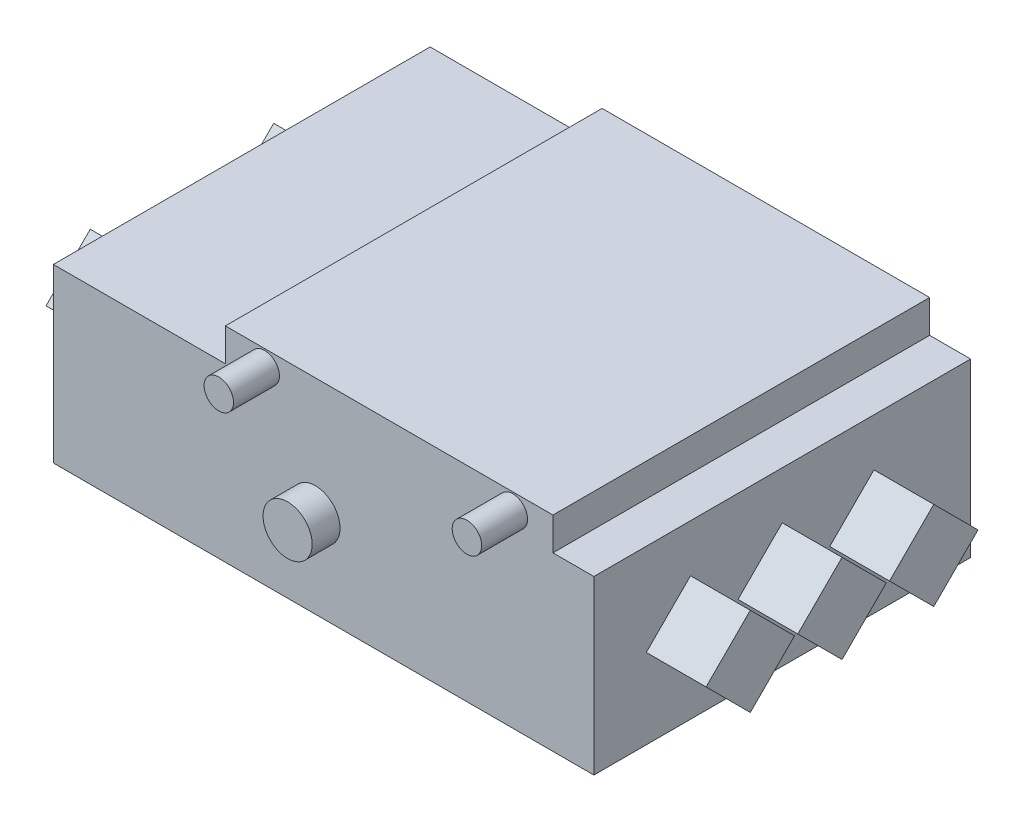
from build123d import *

# Parameters (mm, degrees)
SKETCH1_W           = 330
SKETCH1_H           = 105
BOSS_EXTRUDE1_DEPTH = 230
SKETCH2_W           = 200
SKETCH2_H           = 230
BOSS_EXTRUDE2_DEPTH = 20
SKETCH5_R           = 9
BOSS_EXTRUDE4_DEPTH = 28
SKETCH5_5_R         = 15
BOSS_EXTRUDE5_DEPTH = 17
BOSS_EXTRUDE6_DEPTH = 36.5
MIRROR1_START       = 20.04628694
MIRROR1_OUTLINE_W   = 36.5
MIRROR1_OUTLINE_H   = 38.2
MIRROR1_DEPTH       = 38.2
MIRROR1_START_2     = 99.242246433
MIRROR1_2_OUTLINE_W = 36.5
MIRROR1_2_OUTLINE_H = 38.2
MIRROR1_2_DEPTH     = 38.2


# Read off the part's stored shape, not the designer's step: Mirror1
with BuildPart() as part:
    # Sketch1 → Boss-Extrude1 (new body)
    with BuildSketch(Plane.XY):
        Rectangle(SKETCH1_W, SKETCH1_H)
    extrude(amount=BOSS_EXTRUDE1_DEPTH)

    # Sketch2 → Boss-Extrude2 (add)
    with BuildSketch(Plane(origin=(0, 52.5, 0), x_dir=(1, 0, 0), z_dir=(0, 1, 0))):
        with Locations((40, -115)):
            Rectangle(SKETCH2_W, SKETCH2_H)
    extrude(amount=BOSS_EXTRUDE2_DEPTH)

    # Sketch5 → Boss-Extrude4 (add)
    with BuildSketch(Plane.XY.offset(230)):
        with Locations((115.5, 62.5)):
            Circle(SKETCH5_R)
        with Locations((-36, 62.5)):
            Circle(SKETCH5_R)
    extrude(amount=BOSS_EXTRUDE4_DEPTH)

    # Sketch5<5> → Boss-Extrude5 (add)
    with BuildSketch(Plane.XY.offset(230)):
        with Locations((-5, 0.5)):
            Circle(SKETCH5_5_R)
    extrude(amount=BOSS_EXTRUDE5_DEPTH)

    # Sketch6 → Boss-Extrude6 (add)
    with BuildSketch(Plane(origin=(165, 0, 0), x_dir=(0, 0, -1), z_dir=(1, 0, 0))):
        Polygon((-86.011479041, -3.638790093), (-59, -30.650269134), (-31.988520959, -3.638790093), (-59, 23.372688948), align=None)
        Polygon((-142.011479041, -3.638790093), (-115, -30.650269134), (-87.988520959, -3.638790093), (-115, 23.372688948), align=None)
        Polygon((-198.011479041, -3.638790093), (-171, -30.650269134), (-143.988520959, -3.638790093), (-171, 23.372688948), align=None)
    extrude(amount=BOSS_EXTRUDE6_DEPTH)

    # Mirror1 outline → Mirror1 (add)
    with BuildSketch(Plane(origin=(0, 0, 0), x_dir=(1, 0, 0), z_dir=(0, 0.707106781186546, 0.707106781186549)).offset(MIRROR1_START)):
        with Locations((-183.25, -44.29231324)):
            Rectangle(MIRROR1_OUTLINE_W, MIRROR1_OUTLINE_H)
    extrude(amount=MIRROR1_DEPTH)

    # Mirror1 2 outline → Mirror1 2 (add)
    with BuildSketch(Plane(origin=(0, 0, 0), x_dir=(1, 0, 0), z_dir=(0, 0.707106781186546, 0.707106781186549)).offset(MIRROR1_START_2)):
        with Locations((-183.25, -123.488272733)):
            Rectangle(MIRROR1_2_OUTLINE_W, MIRROR1_2_OUTLINE_H)
    extrude(amount=MIRROR1_2_DEPTH)


solid = part.part
